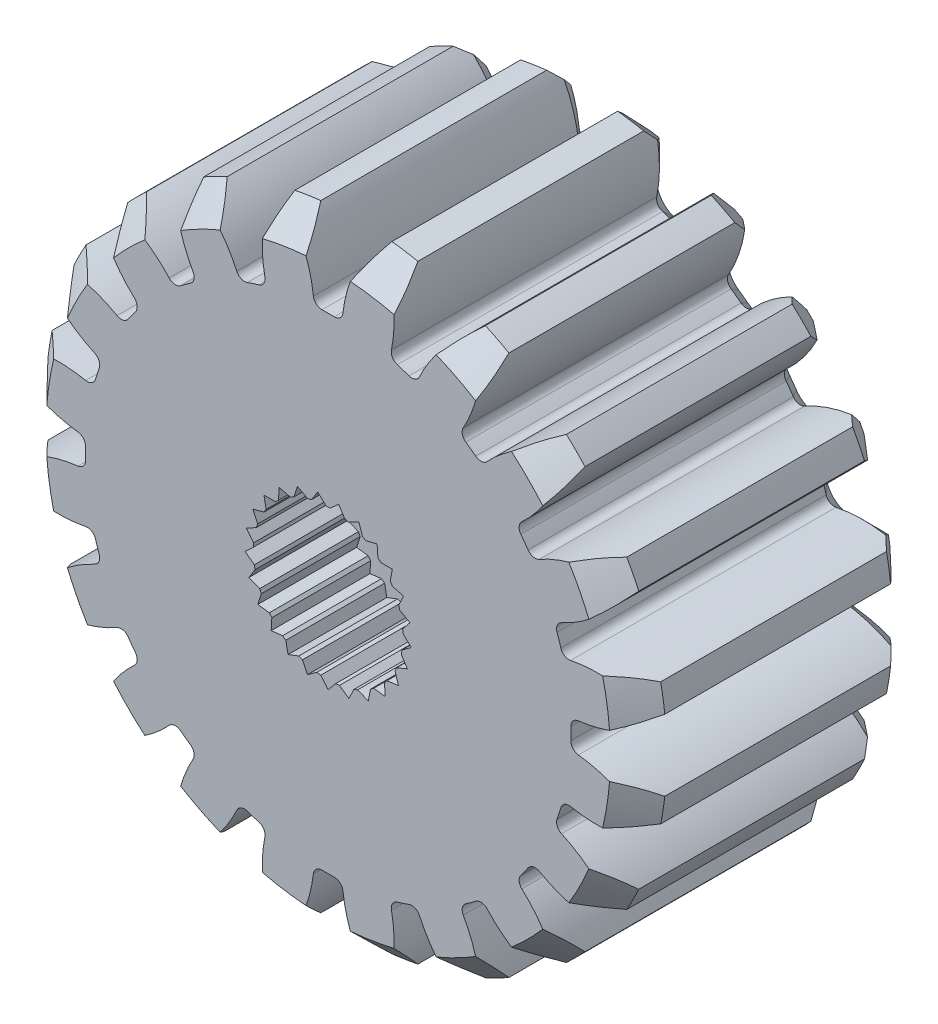
from build123d import *

# Parameters (mm, degrees)
SKETCH2_R                    = 11
BOSS_EXTRUDE1_DEPTH          = 5
CUT_EXTRUDE1_DEPTH           = 17.340134638
FILLET1_R                    = 0.3
CHAMFER1_SIZE                = 1
CHAMFER2_SIZE                = 0.6
CIRPATTERN1_COUNT            = 20
FILLET1_OF_CIRPATTERN1_R     = 0.3
CHAMFER2_OF_CIRPATTERN1_SIZE = 0.6
CUT_EXTRUDE2_DEPTH           = 3.5
CIRPATTERN2_COUNT            = 25
SKETCH5_R                    = 2.65
CUT_EXTRUDE3_DEPTH           = 3.5
SKETCH6_R                    = 1.6
CUT_EXTRUDE4_DEPTH           = 17.765530361
SKETCH7_R                    = 3
CUT_EXTRUDE5_DEPTH           = 5


with BuildPart() as part:
    # Sketch2 → Boss-Extrude1 (new, symmetric)
    with BuildSketch(Plane.XY):
        Circle(SKETCH2_R)
    extrude(amount=BOSS_EXTRUDE1_DEPTH, both=True)

    # Sketch3 → Cut-Extrude1 (cut, symmetric)
    with BuildSketch(Plane.XY):
        with BuildLine():
            ThreePointArc((-2.003514702, 11.831564936), (-0.942497529, 10.351642818), (-0.498977652, 8.585512291))
            ThreePointArc((-0.498977652, 8.585512291), (0, 8.6), (0.498977652, 8.585512291))
            ThreePointArc((0.498977652, 8.585512291), (0.942497529, 10.351642818), (2.003514702, 11.831564936))
            ThreePointArc((2.003514702, 11.831564936), (0, 12), (-2.003514702, 11.831564936))
        make_face()
    cut_extrude1 = extrude(amount=CUT_EXTRUDE1_DEPTH, both=True, mode=Mode.SUBTRACT)

    # Fillet1
    fillet1_edges = [part.edges().sort_by_distance(p)[0] for p in [
        (0.498977652, 8.585512291, 0),
        (-0.498977652, 8.585512291, 0),
    ]]
    fillet(fillet1_edges, radius=FILLET1_R)

    # Chamfer1
    chamfer1_edges = [part.edges().sort_by_distance(p)[0] for p in [
        (0, -11, -5),
        (0, -11, 5),
    ]]
    chamfer(chamfer1_edges, length=CHAMFER1_SIZE)

    # Chamfer2
    chamfer2_edges = [part.edges().sort_by_distance(p)[0] for p in [
        (-0.621428939, 9.423583235, -5),
        (0.621428939, 9.423583235, -5),
        (-0.421754696, 8.670660599, -5),
        (0.421754696, 8.670660599, -5),
        (0, 8.6, -5),
    ]]
    chamfer(chamfer2_edges, length=CHAMFER2_SIZE)

    # CirPattern1: Cut-Extrude1 ×20 about axis
    cirpattern1_axis = Axis((0, 0, 5), (0, 0, -1))
    for i in range(1, CIRPATTERN1_COUNT):
        add(cut_extrude1.rotate(cirpattern1_axis, i * 360 / CIRPATTERN1_COUNT), mode=Mode.SUBTRACT)

    # Fillet1 of CirPattern1
    fillet1_of_cirpattern1_edges = [part.edges().sort_by_distance(p)[0] for p in [
        (3.12762515, 8.011114836, 0),
        (2.178513256, 8.319499984, 0),
        (5.450118908, 6.652533644, 0),
        (4.642756108, 7.239117054, 0),
        (7.239117054, 4.642756108, 0),
        (6.652533644, 5.450118908, 0),
        (8.319499984, 2.178513256, 0),
        (8.011114836, 3.12762515, 0),
        (8.585512291, -0.498977652, 0),
        (8.585512291, 0.498977652, 0),
        (8.011114836, -3.12762515, 0),
        (8.319499984, -2.178513256, 0),
        (6.652533644, -5.450118908, 0),
        (7.239117054, -4.642756108, 0),
        (4.642756108, -7.239117054, 0),
        (5.450118908, -6.652533644, 0),
        (2.178513256, -8.319499984, 0),
        (3.12762515, -8.011114836, 0),
        (-0.498977652, -8.585512291, 0),
        (0.498977652, -8.585512291, 0),
        (-3.12762515, -8.011114836, 0),
        (-2.178513256, -8.319499984, 0),
        (-5.450118908, -6.652533644, 0),
        (-4.642756108, -7.239117054, 0),
        (-7.239117054, -4.642756108, 0),
        (-6.652533644, -5.450118908, 0),
        (-8.319499984, -2.178513256, 0),
        (-8.011114836, -3.12762515, 0),
        (-8.585512291, 0.498977652, 0),
        (-8.585512291, -0.498977652, 0),
        (-8.011114836, 3.12762515, 0),
        (-8.319499984, 2.178513256, 0),
        (-6.652533644, 5.450118908, 0),
        (-7.239117054, 4.642756108, 0),
        (-4.642756108, 7.239117054, 0),
        (-5.450118908, 6.652533644, 0),
        (-2.178513256, 8.319499984, 0),
        (-3.12762515, 8.011114836, 0),
    ]]
    fillet(fillet1_of_cirpattern1_edges, radius=FILLET1_OF_CIRPATTERN1_R)

    # Chamfer2 of CirPattern1
    chamfer2_of_cirpattern1_edges = [part.edges().sort_by_distance(p)[0] for p in [
        (2.321033325, 9.154392345, -5),
        (3.50306141, 8.770328139, -5),
        (2.278268926, 8.376617631, -5),
        (3.080494029, 8.115958894, -5),
        (2.657546152, 8.17908604, -5),
        (5.036296676, 7.989105751, -5),
        (6.041789822, 7.258572219, -5),
        (4.755279711, 7.262612967, -5),
        (5.437693144, 6.766810586, -5),
        (5.05495317, 6.957546152, -5),
        (7.258572219, 6.041789822, -5),
        (7.989105751, 5.036296676, -5),
        (6.766810586, 5.437693144, -5),
        (7.262612967, 4.755279711, -5),
        (6.957546152, 5.05495317, -5),
        (8.770328139, 3.50306141, -5),
        (9.154392345, 2.321033325, -5),
        (8.115958894, 3.080494029, -5),
        (8.376617631, 2.278268926, -5),
        (8.17908604, 2.657546152, -5),
        (9.423583235, 0.621428939, -5),
        (9.423583235, -0.621428939, -5),
        (8.670660599, 0.421754696, -5),
        (8.670660599, -0.421754696, -5),
        (8.6, 0, -5),
        (9.154392345, -2.321033325, -5),
        (8.770328139, -3.50306141, -5),
        (8.376617631, -2.278268926, -5),
        (8.115958894, -3.080494029, -5),
        (8.17908604, -2.657546152, -5),
        (7.989105751, -5.036296676, -5),
        (7.258572219, -6.041789822, -5),
        (7.262612967, -4.755279711, -5),
        (6.766810586, -5.437693144, -5),
        (6.957546152, -5.05495317, -5),
        (6.041789822, -7.258572219, -5),
        (5.036296676, -7.989105751, -5),
        (5.437693144, -6.766810586, -5),
        (4.755279711, -7.262612967, -5),
        (5.05495317, -6.957546152, -5),
        (3.50306141, -8.770328139, -5),
        (2.321033325, -9.154392345, -5),
        (3.080494029, -8.115958894, -5),
        (2.278268926, -8.376617631, -5),
        (2.657546152, -8.17908604, -5),
        (0.621428939, -9.423583235, -5),
        (-0.621428939, -9.423583235, -5),
        (0.421754696, -8.670660599, -5),
        (-0.421754696, -8.670660599, -5),
        (0, -8.6, -5),
        (-2.321033325, -9.154392345, -5),
        (-3.50306141, -8.770328139, -5),
        (-2.278268926, -8.376617631, -5),
        (-3.080494029, -8.115958894, -5),
        (-2.657546152, -8.17908604, -5),
        (-5.036296676, -7.989105751, -5),
        (-6.041789822, -7.258572219, -5),
        (-4.755279711, -7.262612967, -5),
        (-5.437693144, -6.766810586, -5),
        (-5.05495317, -6.957546152, -5),
        (-7.258572219, -6.041789822, -5),
        (-7.989105751, -5.036296676, -5),
        (-6.766810586, -5.437693144, -5),
        (-7.262612967, -4.755279711, -5),
        (-6.957546152, -5.05495317, -5),
        (-8.770328139, -3.50306141, -5),
        (-9.154392345, -2.321033325, -5),
        (-8.115958894, -3.080494029, -5),
        (-8.376617631, -2.278268926, -5),
        (-8.17908604, -2.657546152, -5),
        (-9.423583235, -0.621428939, -5),
        (-9.423583235, 0.621428939, -5),
        (-8.670660599, -0.421754696, -5),
        (-8.670660599, 0.421754696, -5),
        (-8.6, 0, -5),
        (-9.154392345, 2.321033325, -5),
        (-8.770328139, 3.50306141, -5),
        (-8.376617631, 2.278268926, -5),
        (-8.115958894, 3.080494029, -5),
        (-8.17908604, 2.657546152, -5),
        (-7.989105751, 5.036296676, -5),
        (-7.258572219, 6.041789822, -5),
        (-7.262612967, 4.755279711, -5),
        (-6.766810586, 5.437693144, -5),
        (-6.957546152, 5.05495317, -5),
        (-6.041789822, 7.258572219, -5),
        (-5.036296676, 7.989105751, -5),
        (-5.437693144, 6.766810586, -5),
        (-4.755279711, 7.262612967, -5),
        (-5.05495317, 6.957546152, -5),
        (-3.50306141, 8.770328139, -5),
        (-2.321033325, 9.154392345, -5),
        (-3.080494029, 8.115958894, -5),
        (-2.278268926, 8.376617631, -5),
        (-2.657546152, 8.17908604, -5),
    ]]
    chamfer(chamfer2_of_cirpattern1_edges, length=CHAMFER2_OF_CIRPATTERN1_SIZE)

    # Sketch4 → Cut-Extrude2 (cut)
    with BuildSketch(Plane.XY.offset(5)):
        with BuildLine():
            Line((-0.262681209, -2.636948726), (0, -2.95))
            Line((0, -2.95), (0.262681209, -2.636948726))
            ThreePointArc((0.262681209, -2.636948726), (0, -2.65), (-0.262681209, -2.636948726))
        make_face()
    cut_extrude2 = extrude(amount=-CUT_EXTRUDE2_DEPTH, mode=Mode.SUBTRACT)

    # CirPattern2: Cut-Extrude2 ×25 about axis
    cirpattern2_axis = Axis((0, 0, 5), (0, 0, -1))
    for i in range(1, CIRPATTERN2_COUNT):
        add(cut_extrude2.rotate(cirpattern2_axis, i * 360 / CIRPATTERN2_COUNT), mode=Mode.SUBTRACT)

    # Sketch5 → Cut-Extrude3 (cut)
    with BuildSketch(Plane.XY.offset(5)):
        Circle(SKETCH5_R)
    extrude(amount=-CUT_EXTRUDE3_DEPTH, mode=Mode.SUBTRACT)

    # Sketch6 → Cut-Extrude4 (cut, through all)
    with BuildSketch(Plane.XY.offset(1.5)):
        Circle(SKETCH6_R)
    extrude(amount=-CUT_EXTRUDE4_DEPTH, mode=Mode.SUBTRACT)

    # Sketch7 → Cut-Extrude5 (cut)
    with BuildSketch(Plane(origin=(0, 0, -5), x_dir=(-1, 0, 0), z_dir=(0, 0, -1))):
        Circle(SKETCH7_R)
    extrude(amount=-CUT_EXTRUDE5_DEPTH, mode=Mode.SUBTRACT)


solid = part.part
